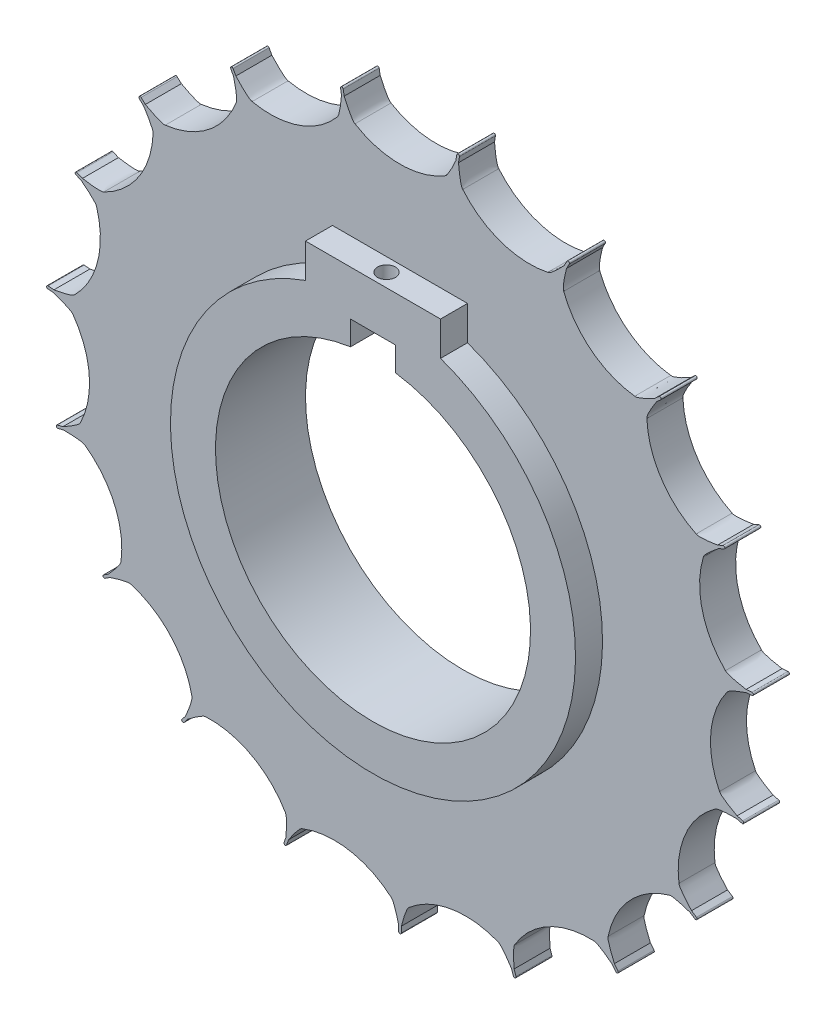
from build123d import *

# Parameters (mm, degrees)
BOSS_EXTRUDE1_DEPTH              = 2
BOSS_EXTRUDE1_DEPTH_BACK         = 2
SKETCH1_R                        = 36.375
BOSS_EXTRUDE2_DEPTH              = 9
SKETCH3_R                        = 39.875
BOSS_EXTRUDE3_DEPTH              = 4
CUT_EXTRUDE2_DEPTH               = 9
BOSS_EXTRUDE5_DEPTH              = 3
BOSS_EXTRUDE5_DEPTH_BACK         = 7
SKETCH7_R                        = 1
CUT_EXTRUDE3_DEPTH               = 10
CUT_EXTRUDE4_REACH               = 59.654
CIRPATTERN1_COUNT                = 19
BOSS_EXTRUDE6_DEPTH              = 4
FILLET1_RADIUS                   = 0.15
FILLET1_LENGTH                   = 4
CIRPATTERN2_COUNT                = 19
FILLET1_OF_CIRPATTERN2_2_RADIUS  = 0.15
FILLET1_OF_CIRPATTERN2_2_LENGTH  = 4
FILLET1_OF_CIRPATTERN2_3_RADIUS  = 0.15
FILLET1_OF_CIRPATTERN2_3_LENGTH  = 4
FILLET1_OF_CIRPATTERN2_4_RADIUS  = 0.15
FILLET1_OF_CIRPATTERN2_4_LENGTH  = 4
FILLET1_OF_CIRPATTERN2_5_RADIUS  = 0.15
FILLET1_OF_CIRPATTERN2_5_LENGTH  = 4
FILLET1_OF_CIRPATTERN2_6_RADIUS  = 0.15
FILLET1_OF_CIRPATTERN2_6_LENGTH  = 4
FILLET1_OF_CIRPATTERN2_7_RADIUS  = 0.15
FILLET1_OF_CIRPATTERN2_7_LENGTH  = 4
FILLET1_OF_CIRPATTERN2_8_RADIUS  = 0.15
FILLET1_OF_CIRPATTERN2_8_LENGTH  = 4
FILLET1_OF_CIRPATTERN2_9_RADIUS  = 0.15
FILLET1_OF_CIRPATTERN2_9_LENGTH  = 4
FILLET1_OF_CIRPATTERN2_10_RADIUS = 0.15
FILLET1_OF_CIRPATTERN2_10_LENGTH = 4
FILLET1_OF_CIRPATTERN2_11_RADIUS = 0.15
FILLET1_OF_CIRPATTERN2_11_LENGTH = 4
FILLET1_OF_CIRPATTERN2_12_RADIUS = 0.15
FILLET1_OF_CIRPATTERN2_12_LENGTH = 4
FILLET1_OF_CIRPATTERN2_13_RADIUS = 0.15
FILLET1_OF_CIRPATTERN2_13_LENGTH = 4
FILLET1_OF_CIRPATTERN2_14_RADIUS = 0.15
FILLET1_OF_CIRPATTERN2_14_LENGTH = 4
FILLET1_OF_CIRPATTERN2_15_RADIUS = 0.15
FILLET1_OF_CIRPATTERN2_15_LENGTH = 4
FILLET1_OF_CIRPATTERN2_16_RADIUS = 0.15
FILLET1_OF_CIRPATTERN2_16_LENGTH = 4
FILLET1_OF_CIRPATTERN2_17_RADIUS = 0.15
FILLET1_OF_CIRPATTERN2_17_LENGTH = 4
FILLET1_OF_CIRPATTERN2_18_RADIUS = 0.15
FILLET1_OF_CIRPATTERN2_18_LENGTH = 4
FILLET1_OF_CIRPATTERN2_19_RADIUS = 0.15
FILLET1_OF_CIRPATTERN2_19_LENGTH = 4


with BuildPart() as part:
    # Sketch1 → Boss-Extrude1 (new, two sides: drawn at the far end of the back side and taken through both)
    with BuildSketch(Plane.XY.offset(-BOSS_EXTRUDE1_DEPTH_BACK)):
        Circle(SKETCH1_R)
    extrude(amount=BOSS_EXTRUDE1_DEPTH + BOSS_EXTRUDE1_DEPTH_BACK)

    # Sketch2 → Boss-Extrude2 (add)
    with BuildSketch(Plane.XY.offset(2)):
        with BuildLine():
            add(Edge.make_bspline(
                [(-5, 36.029718636), (-5.16736878, 36.130582324), (-5.432588625, 36.539534021), (-5.85563855, 37.287033981), (-6.265720352, 38.310506492), (-6.754258246, 39.010871717), (-7.125429553, 39.23319868)],
                knots=[0, 0, 0, 0, 0.148725202, 0.36228267, 0.669737226, 1, 1, 1, 1], degree=3))
            ThreePointArc((-5, 36.029718636), (0, 36.375), (5, 36.029718636))
            add(Edge.make_bspline(
                [(5, 36.029718636), (5.16736878, 36.130582324), (5.432588625, 36.539534021), (5.85563855, 37.287033981), (6.265720352, 38.310506492), (6.754258246, 39.010871717), (7.125429553, 39.23319868)],
                knots=[0, 0, 0, 0, 0.148725202, 0.36228267, 0.669737226, 1, 1, 1, 1], degree=3))
            ThreePointArc((7.125429553, 39.23319868), (0, 39.875), (-7.125429553, 39.23319868))
        make_face()
        with BuildLine():
            ThreePointArc((5, 36.029718636), (0, 36.375), (-5, 36.029718636))
            ThreePointArc((-5, 36.029718636), (0, 34.639571543), (5, 36.029718636))
        make_face()
    extrude(amount=-BOSS_EXTRUDE2_DEPTH)

    # Sketch3 → Boss-Extrude3 (add)
    with BuildSketch(Plane.XY.offset(2)):
        Circle(SKETCH3_R)
    extrude(amount=-BOSS_EXTRUDE3_DEPTH)

    # Sketch5 → Cut-Extrude2 (cut)
    with BuildSketch(Plane.XY.offset(2)):
        with BuildLine():
            Line((-2.5, 20), (2.5, 20))
            Line((2.5, 20), (2.5, 17.320508076))
            ThreePointArc((2.5, 17.320508076), (0, -17.5), (-2.5, 17.320508076))
            Line((-2.5, 17.320508076), (-2.5, 20))
        make_face()
    extrude(amount=-CUT_EXTRUDE2_DEPTH, mode=Mode.SUBTRACT)

    # Sketch6 → Boss-Extrude5 (add, two sides: drawn at the far end of the back side and taken through both)
    with BuildSketch(Plane.XY.offset(2).offset(-BOSS_EXTRUDE5_DEPTH_BACK)):
        with BuildLine():
            Line((7.5, 21.213203436), (7.5, 25))
            Line((7.5, 25), (-7.5, 25))
            Line((-7.5, 25), (-7.5, 21.213203436))
            ThreePointArc((-7.5, 21.213203436), (0, -22.5), (7.5, 21.213203436))
        make_face()
        with BuildLine():
            Line((2.5, 17.320508076), (2.5, 20))
            Line((2.5, 20), (-2.5, 20))
            Line((-2.5, 20), (-2.5, 17.320508076))
            ThreePointArc((-2.5, 17.320508076), (0, -17.5), (2.5, 17.320508076))
        make_face(mode=Mode.SUBTRACT)
    extrude(amount=BOSS_EXTRUDE5_DEPTH + BOSS_EXTRUDE5_DEPTH_BACK)

    # Sketch7 → Cut-Extrude3 (cut)
    with BuildSketch(Plane(origin=(0, 25, 0), x_dir=(1, 0, 0), z_dir=(0, 1, 0))):
        with Locations(Location((0, -3.5, 0), (0, 0, 270))):
            Circle(SKETCH7_R)
    extrude(amount=-CUT_EXTRUDE3_DEPTH, mode=Mode.SUBTRACT)

    # Sketch11 → Cut-Extrude4 (cut, up to next)
    with BuildSketch(Plane(origin=(0, 0, -7), x_dir=(-1, 0, 0), z_dir=(0, 0, -1)), mode=Mode.PRIVATE) as cut_extrude4_sk1:
        with BuildLine():
            ThreePointArc((7.125429553, 39.23319868), (0, 39.875), (-7.125429553, 39.23319868))
            add(Edge.make_bspline(
                [(-7.125429553, 39.23319868), (-6.754258246, 39.010871717), (-6.265720352, 38.310506492), (-5.85563855, 37.287033981), (-5.432588625, 36.539534021), (-5.16736878, 36.130582324), (-5, 36.029718636)],
                knots=[0, 0, 0, 0, 0.330262774, 0.63771733, 0.851274798, 1, 1, 1, 1], degree=3))
            ThreePointArc((-5, 36.029718636), (0, 34.639571543), (5, 36.029718636))
            add(Edge.make_bspline(
                [(5, 36.029718636), (5.16736878, 36.130582324), (5.432588625, 36.539534021), (5.85563855, 37.287033981), (6.265720352, 38.310506492), (6.754258246, 39.010871717), (7.125429553, 39.23319868)],
                knots=[0, 0, 0, 0, 0.148725202, 0.36228267, 0.669737226, 1, 1, 1, 1], degree=3))
        make_face()
    cut_extrude4_tool1 = extrude(cut_extrude4_sk1.sketch, amount=-CUT_EXTRUDE4_REACH, mode=Mode.PRIVATE) & part.part
    cut_extrude4 = cut_extrude4_tool1.solids().sort_by_distance((0, 37.521831, -7))[0]
    add(cut_extrude4, mode=Mode.SUBTRACT)

    # CirPattern1: Cut-Extrude4 ×19 about axis
    cirpattern1_axis = Axis((0, 0, 0), (0, 0, -1))
    for i in range(1, CIRPATTERN1_COUNT):
        add(cut_extrude4.rotate(cirpattern1_axis, i * 360 / CIRPATTERN1_COUNT), mode=Mode.SUBTRACT)

    # Sketch12 → Boss-Extrude6 (add)
    with BuildSketch(Plane.XY.offset(2)):
        Polygon((-6.4993162, 38.036936687), (-6.203407797, 38.086314991), (-6.335083273, 38.875404067), (-6.630991676, 38.826025763), align=None)
    boss_extrude6 = extrude(amount=-BOSS_EXTRUDE6_DEPTH)

    # Fillet1: full round fillet: the end face becomes a half cylinder, R = half its width
    fillet1_face = Plane((-6.483037475, 38.850714915, 0), x_dir=(0, 0, 1), z_dir=(-0.164594345497, 0.98636134425, 0))  # on the end face: x along it, z out of the body
    fillet1_slab = fillet1_face.offset(-FILLET1_RADIUS / 2) * Box(FILLET1_LENGTH, 2 * FILLET1_RADIUS, FILLET1_RADIUS, mode=Mode.PRIVATE)  # the body's end, R deep
    fillet1_round = Plane((-6.458348323, 38.702760713, 0), x_dir=(-0.164594345497, 0.98636134425, 0), z_dir=(0, 0, 1)) * Cylinder(FILLET1_RADIUS, FILLET1_LENGTH, mode=Mode.PRIVATE)  # its axis R under the face
    add(fillet1_slab - fillet1_round, mode=Mode.SUBTRACT)

    # CirPattern2: Boss-Extrude6 ×19 about axis
    cirpattern2_axis = Axis((0, 0, 0), (0, 0, 1))
    for i in range(1, CIRPATTERN2_COUNT):
        add(boss_extrude6.rotate(cirpattern2_axis, i * 360 / CIRPATTERN2_COUNT))

    # Fillet1 of CirPattern2 2: full round fillet: the end face becomes a half cylinder, R = half its width
    fillet1_of_cirpattern2_2_face = Plane((-18.746575134, 34.640637192, 0), x_dir=(0, 0, 1), z_dir=(-0.475947174779, 0.879473869322, 0))  # on the end face: x along it, z out of the body
    fillet1_of_cirpattern2_2_slab = fillet1_of_cirpattern2_2_face.offset(-FILLET1_OF_CIRPATTERN2_2_RADIUS / 2) * Box(FILLET1_OF_CIRPATTERN2_2_LENGTH, 2 * FILLET1_OF_CIRPATTERN2_2_RADIUS, FILLET1_OF_CIRPATTERN2_2_RADIUS, mode=Mode.PRIVATE)  # the body's end, R deep
    fillet1_of_cirpattern2_2_round = Plane((-18.675183058, 34.508716112, 0), x_dir=(-0.475947174779, 0.879473869322, 0), z_dir=(0, 0, 1)) * Cylinder(FILLET1_OF_CIRPATTERN2_2_RADIUS, FILLET1_OF_CIRPATTERN2_2_LENGTH, mode=Mode.PRIVATE)  # its axis R under the face
    add(fillet1_of_cirpattern2_2_slab - fillet1_of_cirpattern2_2_round, mode=Mode.SUBTRACT)

    # Fillet1 of CirPattern2 3: full round fillet: the end face becomes a half cylinder, R = half its width
    fillet1_of_cirpattern2_3_face = Plane((-28.978630493, 26.676708924, 0), x_dir=(0, 0, 1), z_dir=(-0.735723742593, 0.677281754209, 0))  # on the end face: x along it, z out of the body
    fillet1_of_cirpattern2_3_slab = fillet1_of_cirpattern2_3_face.offset(-FILLET1_OF_CIRPATTERN2_3_RADIUS / 2) * Box(FILLET1_OF_CIRPATTERN2_3_LENGTH, 2 * FILLET1_OF_CIRPATTERN2_3_RADIUS, FILLET1_OF_CIRPATTERN2_3_RADIUS, mode=Mode.PRIVATE)  # the body's end, R deep
    fillet1_of_cirpattern2_3_round = Plane((-28.868271932, 26.575116661, 0), x_dir=(-0.735723742593, 0.677281754209, 0), z_dir=(0, 0, 1)) * Cylinder(FILLET1_OF_CIRPATTERN2_3_RADIUS, FILLET1_OF_CIRPATTERN2_3_LENGTH, mode=Mode.PRIVATE)  # its axis R under the face
    add(fillet1_of_cirpattern2_3_slab - fillet1_of_cirpattern2_3_round, mode=Mode.SUBTRACT)

    # Fillet1 of CirPattern2 4: full round fillet: the end face becomes a half cylinder, R = half its width
    fillet1_of_cirpattern2_4_face = Plane((-36.070401589, 15.821945313, 0), x_dir=(0, 0, 1), z_dir=(-0.915773226967, 0.401695651919, 0))  # on the end face: x along it, z out of the body
    fillet1_of_cirpattern2_4_slab = fillet1_of_cirpattern2_4_face.offset(-FILLET1_OF_CIRPATTERN2_4_RADIUS / 2) * Box(FILLET1_OF_CIRPATTERN2_4_LENGTH, 2 * FILLET1_OF_CIRPATTERN2_4_RADIUS, FILLET1_OF_CIRPATTERN2_4_RADIUS, mode=Mode.PRIVATE)  # the body's end, R deep
    fillet1_of_cirpattern2_4_round = Plane((-35.933035605, 15.761690965, 0), x_dir=(-0.915773226967, 0.401695651919, 0), z_dir=(0, 0, 1)) * Cylinder(FILLET1_OF_CIRPATTERN2_4_RADIUS, FILLET1_OF_CIRPATTERN2_4_LENGTH, mode=Mode.PRIVATE)  # its axis R under the face
    add(fillet1_of_cirpattern2_4_slab - fillet1_of_cirpattern2_4_round, mode=Mode.SUBTRACT)

    # Fillet1 of CirPattern2 5: full round fillet: the end face becomes a half cylinder, R = half its width
    fillet1_of_cirpattern2_5_face = Plane((-39.253384983, 3.252628424, 0), x_dir=(0, 0, 1), z_dir=(-0.996584472513, 0.082579592793, 0))  # on the end face: x along it, z out of the body
    fillet1_of_cirpattern2_5_slab = fillet1_of_cirpattern2_5_face.offset(-FILLET1_OF_CIRPATTERN2_5_RADIUS / 2) * Box(FILLET1_OF_CIRPATTERN2_5_LENGTH, 2 * FILLET1_OF_CIRPATTERN2_5_RADIUS, FILLET1_OF_CIRPATTERN2_5_RADIUS, mode=Mode.PRIVATE)  # the body's end, R deep
    fillet1_of_cirpattern2_5_round = Plane((-39.103897312, 3.240241485, 0), x_dir=(-0.996584472513, 0.082579592793, 0), z_dir=(0, 0, 1)) * Cylinder(FILLET1_OF_CIRPATTERN2_5_RADIUS, FILLET1_OF_CIRPATTERN2_5_LENGTH, mode=Mode.PRIVATE)  # its axis R under the face
    add(fillet1_of_cirpattern2_5_slab - fillet1_of_cirpattern2_5_round, mode=Mode.SUBTRACT)

    # Fillet1 of CirPattern2 6: full round fillet: the end face becomes a half cylinder, R = half its width
    fillet1_of_cirpattern2_6_face = Plane((-38.182655035, -9.669161224, 0), x_dir=(0, 0, 1), z_dir=(-0.969400326861, -0.245485246566, 0))  # on the end face: x along it, z out of the body
    fillet1_of_cirpattern2_6_slab = fillet1_of_cirpattern2_6_face.offset(-FILLET1_OF_CIRPATTERN2_6_RADIUS / 2) * Box(FILLET1_OF_CIRPATTERN2_6_LENGTH, 2 * FILLET1_OF_CIRPATTERN2_6_RADIUS, FILLET1_OF_CIRPATTERN2_6_RADIUS, mode=Mode.PRIVATE)  # the body's end, R deep
    fillet1_of_cirpattern2_6_round = Plane((-38.037244986, -9.632338437, 0), x_dir=(-0.969400326861, -0.245485246566, 0), z_dir=(0, 0, 1)) * Cylinder(FILLET1_OF_CIRPATTERN2_6_RADIUS, FILLET1_OF_CIRPATTERN2_6_LENGTH, mode=Mode.PRIVATE)  # its axis R under the face
    add(fillet1_of_cirpattern2_6_slab - fillet1_of_cirpattern2_6_round, mode=Mode.SUBTRACT)

    # Fillet1 of CirPattern2 7: full round fillet: the end face becomes a half cylinder, R = half its width
    fillet1_of_cirpattern2_7_face = Plane((-32.974241949, -21.543147221, 0), x_dir=(0, 0, 1), z_dir=(-0.837166613998, -0.546947950364, 0))  # on the end face: x along it, z out of the body
    fillet1_of_cirpattern2_7_slab = fillet1_of_cirpattern2_7_face.offset(-FILLET1_OF_CIRPATTERN2_7_RADIUS / 2) * Box(FILLET1_OF_CIRPATTERN2_7_LENGTH, 2 * FILLET1_OF_CIRPATTERN2_7_RADIUS, FILLET1_OF_CIRPATTERN2_7_RADIUS, mode=Mode.PRIVATE)  # the body's end, R deep
    fillet1_of_cirpattern2_7_round = Plane((-32.848666957, -21.461105028, 0), x_dir=(-0.837166613998, -0.546947950364, 0), z_dir=(0, 0, 1)) * Cylinder(FILLET1_OF_CIRPATTERN2_7_RADIUS, FILLET1_OF_CIRPATTERN2_7_LENGTH, mode=Mode.PRIVATE)  # its axis R under the face
    add(fillet1_of_cirpattern2_7_slab - fillet1_of_cirpattern2_7_round, mode=Mode.SUBTRACT)

    # Fillet1 of CirPattern2 8: full round fillet: the end face becomes a half cylinder, R = half its width
    fillet1_of_cirpattern2_8_face = Plane((-24.1925581, -31.082598941, 0), x_dir=(0, 0, 1), z_dir=(-0.614212908529, -0.789140356968, 0))  # on the end face: x along it, z out of the body
    fillet1_of_cirpattern2_8_slab = fillet1_of_cirpattern2_8_face.offset(-FILLET1_OF_CIRPATTERN2_8_RADIUS / 2) * Box(FILLET1_OF_CIRPATTERN2_8_LENGTH, 2 * FILLET1_OF_CIRPATTERN2_8_RADIUS, FILLET1_OF_CIRPATTERN2_8_RADIUS, mode=Mode.PRIVATE)  # the body's end, R deep
    fillet1_of_cirpattern2_8_round = Plane((-24.100426164, -30.964227887, 0), x_dir=(-0.614212908529, -0.789140356968, 0), z_dir=(0, 0, 1)) * Cylinder(FILLET1_OF_CIRPATTERN2_8_RADIUS, FILLET1_OF_CIRPATTERN2_8_LENGTH, mode=Mode.PRIVATE)  # its axis R under the face
    add(fillet1_of_cirpattern2_8_slab - fillet1_of_cirpattern2_8_round, mode=Mode.SUBTRACT)

    # Fillet1 of CirPattern2 9: full round fillet: the end face becomes a half cylinder, R = half its width
    fillet1_of_cirpattern2_9_face = Plane((-12.789235194, -37.253768769, 0), x_dir=(0, 0, 1), z_dir=(-0.324699703927, -0.945817161121, 0))  # on the end face: x along it, z out of the body
    fillet1_of_cirpattern2_9_slab = fillet1_of_cirpattern2_9_face.offset(-FILLET1_OF_CIRPATTERN2_9_RADIUS / 2) * Box(FILLET1_OF_CIRPATTERN2_9_LENGTH, 2 * FILLET1_OF_CIRPATTERN2_9_RADIUS, FILLET1_OF_CIRPATTERN2_9_RADIUS, mode=Mode.PRIVATE)  # the body's end, R deep
    fillet1_of_cirpattern2_9_round = Plane((-12.740530238, -37.111896195, 0), x_dir=(-0.324699703927, -0.945817161121, 0), z_dir=(0, 0, 1)) * Cylinder(FILLET1_OF_CIRPATTERN2_9_RADIUS, FILLET1_OF_CIRPATTERN2_9_LENGTH, mode=Mode.PRIVATE)  # its axis R under the face
    add(fillet1_of_cirpattern2_9_slab - fillet1_of_cirpattern2_9_round, mode=Mode.SUBTRACT)

    # Fillet1 of CirPattern2 10: full round fillet: the end face becomes a half cylinder, R = half its width
    fillet1_of_cirpattern2_10_face = Plane((-2.1e-07, -39.387914699, 0), x_dir=(0, 0, 1), z_dir=(-2.48168e-07, -1.0, 0))  # on the end face: x along it, z out of the body
    fillet1_of_cirpattern2_10_slab = fillet1_of_cirpattern2_10_face.offset(-FILLET1_OF_CIRPATTERN2_10_RADIUS / 2) * Box(FILLET1_OF_CIRPATTERN2_10_LENGTH, 2 * FILLET1_OF_CIRPATTERN2_10_RADIUS, FILLET1_OF_CIRPATTERN2_10_RADIUS, mode=Mode.PRIVATE)  # the body's end, R deep
    fillet1_of_cirpattern2_10_round = Plane((-1.73e-07, -39.237914699, 0), x_dir=(-2.48168e-07, -1.0, 0), z_dir=(0, 0, 1)) * Cylinder(FILLET1_OF_CIRPATTERN2_10_RADIUS, FILLET1_OF_CIRPATTERN2_10_LENGTH, mode=Mode.PRIVATE)  # its axis R under the face
    add(fillet1_of_cirpattern2_10_slab - fillet1_of_cirpattern2_10_round, mode=Mode.SUBTRACT)

    # Fillet1 of CirPattern2 11: full round fillet: the end face becomes a half cylinder, R = half its width
    fillet1_of_cirpattern2_11_face = Plane((12.789234797, -37.253768905, 0), x_dir=(0, 0, 1), z_dir=(0.324699234483, -0.945817322281, 0))  # on the end face: x along it, z out of the body
    fillet1_of_cirpattern2_11_slab = fillet1_of_cirpattern2_11_face.offset(-FILLET1_OF_CIRPATTERN2_11_RADIUS / 2) * Box(FILLET1_OF_CIRPATTERN2_11_LENGTH, 2 * FILLET1_OF_CIRPATTERN2_11_RADIUS, FILLET1_OF_CIRPATTERN2_11_RADIUS, mode=Mode.PRIVATE)  # the body's end, R deep
    fillet1_of_cirpattern2_11_round = Plane((12.740529912, -37.111896307, 0), x_dir=(0.324699234483, -0.945817322281, 0), z_dir=(0, 0, 1)) * Cylinder(FILLET1_OF_CIRPATTERN2_11_RADIUS, FILLET1_OF_CIRPATTERN2_11_LENGTH, mode=Mode.PRIVATE)  # its axis R under the face
    add(fillet1_of_cirpattern2_11_slab - fillet1_of_cirpattern2_11_round, mode=Mode.SUBTRACT)

    # Fillet1 of CirPattern2 12: full round fillet: the end face becomes a half cylinder, R = half its width
    fillet1_of_cirpattern2_12_face = Plane((24.192557769, -31.082599198, 0), x_dir=(0, 0, 1), z_dir=(0.61421251685, -0.789140661825, 0))  # on the end face: x along it, z out of the body
    fillet1_of_cirpattern2_12_slab = fillet1_of_cirpattern2_12_face.offset(-FILLET1_OF_CIRPATTERN2_12_RADIUS / 2) * Box(FILLET1_OF_CIRPATTERN2_12_LENGTH, 2 * FILLET1_OF_CIRPATTERN2_12_RADIUS, FILLET1_OF_CIRPATTERN2_12_RADIUS, mode=Mode.PRIVATE)  # the body's end, R deep
    fillet1_of_cirpattern2_12_round = Plane((24.100425891, -30.964228099, 0), x_dir=(0.61421251685, -0.789140661825, 0), z_dir=(0, 0, 1)) * Cylinder(FILLET1_OF_CIRPATTERN2_12_RADIUS, FILLET1_OF_CIRPATTERN2_12_LENGTH, mode=Mode.PRIVATE)  # its axis R under the face
    add(fillet1_of_cirpattern2_12_slab - fillet1_of_cirpattern2_12_round, mode=Mode.SUBTRACT)

    # Fillet1 of CirPattern2 13: full round fillet: the end face becomes a half cylinder, R = half its width
    fillet1_of_cirpattern2_13_face = Plane((32.97424172, -21.543147572, 0), x_dir=(0, 0, 1), z_dir=(0.837166342527, -0.546948365881, 0))  # on the end face: x along it, z out of the body
    fillet1_of_cirpattern2_13_slab = fillet1_of_cirpattern2_13_face.offset(-FILLET1_OF_CIRPATTERN2_13_RADIUS / 2) * Box(FILLET1_OF_CIRPATTERN2_13_LENGTH, 2 * FILLET1_OF_CIRPATTERN2_13_RADIUS, FILLET1_OF_CIRPATTERN2_13_RADIUS, mode=Mode.PRIVATE)  # the body's end, R deep
    fillet1_of_cirpattern2_13_round = Plane((32.848666769, -21.461105317, 0), x_dir=(0.837166342527, -0.546948365881, 0), z_dir=(0, 0, 1)) * Cylinder(FILLET1_OF_CIRPATTERN2_13_RADIUS, FILLET1_OF_CIRPATTERN2_13_LENGTH, mode=Mode.PRIVATE)  # its axis R under the face
    add(fillet1_of_cirpattern2_13_slab - fillet1_of_cirpattern2_13_round, mode=Mode.SUBTRACT)

    # Fillet1 of CirPattern2 14: full round fillet: the end face becomes a half cylinder, R = half its width
    fillet1_of_cirpattern2_14_face = Plane((38.182654932, -9.669161631, 0), x_dir=(0, 0, 1), z_dir=(0.969400205018, -0.245485727715, 0))  # on the end face: x along it, z out of the body
    fillet1_of_cirpattern2_14_slab = fillet1_of_cirpattern2_14_face.offset(-FILLET1_OF_CIRPATTERN2_14_RADIUS / 2) * Box(FILLET1_OF_CIRPATTERN2_14_LENGTH, 2 * FILLET1_OF_CIRPATTERN2_14_RADIUS, FILLET1_OF_CIRPATTERN2_14_RADIUS, mode=Mode.PRIVATE)  # the body's end, R deep
    fillet1_of_cirpattern2_14_round = Plane((38.037244901, -9.632338772, 0), x_dir=(0.969400205018, -0.245485727715, 0), z_dir=(0, 0, 1)) * Cylinder(FILLET1_OF_CIRPATTERN2_14_RADIUS, FILLET1_OF_CIRPATTERN2_14_LENGTH, mode=Mode.PRIVATE)  # its axis R under the face
    add(fillet1_of_cirpattern2_14_slab - fillet1_of_cirpattern2_14_round, mode=Mode.SUBTRACT)

    # Fillet1 of CirPattern2 15: full round fillet: the end face becomes a half cylinder, R = half its width
    fillet1_of_cirpattern2_15_face = Plane((39.253385018, 3.252628006, 0), x_dir=(0, 0, 1), z_dir=(0.9965845135, 0.082579098152, 0))  # on the end face: x along it, z out of the body
    fillet1_of_cirpattern2_15_slab = fillet1_of_cirpattern2_15_face.offset(-FILLET1_OF_CIRPATTERN2_15_RADIUS / 2) * Box(FILLET1_OF_CIRPATTERN2_15_LENGTH, 2 * FILLET1_OF_CIRPATTERN2_15_RADIUS, FILLET1_OF_CIRPATTERN2_15_RADIUS, mode=Mode.PRIVATE)  # the body's end, R deep
    fillet1_of_cirpattern2_15_round = Plane((39.103897341, 3.240241141, 0), x_dir=(0.9965845135, 0.082579098152, 0), z_dir=(0, 0, 1)) * Cylinder(FILLET1_OF_CIRPATTERN2_15_RADIUS, FILLET1_OF_CIRPATTERN2_15_LENGTH, mode=Mode.PRIVATE)  # its axis R under the face
    add(fillet1_of_cirpattern2_15_slab - fillet1_of_cirpattern2_15_round, mode=Mode.SUBTRACT)

    # Fillet1 of CirPattern2 16: full round fillet: the end face becomes a half cylinder, R = half its width
    fillet1_of_cirpattern2_16_face = Plane((36.070401758, 15.821944929, 0), x_dir=(0, 0, 1), z_dir=(0.915773426343, 0.401695197387, 0))  # on the end face: x along it, z out of the body
    fillet1_of_cirpattern2_16_slab = fillet1_of_cirpattern2_16_face.offset(-FILLET1_OF_CIRPATTERN2_16_RADIUS / 2) * Box(FILLET1_OF_CIRPATTERN2_16_LENGTH, 2 * FILLET1_OF_CIRPATTERN2_16_RADIUS, FILLET1_OF_CIRPATTERN2_16_RADIUS, mode=Mode.PRIVATE)  # the body's end, R deep
    fillet1_of_cirpattern2_16_round = Plane((35.933035744, 15.761690649, 0), x_dir=(0.915773426343, 0.401695197387, 0), z_dir=(0, 0, 1)) * Cylinder(FILLET1_OF_CIRPATTERN2_16_RADIUS, FILLET1_OF_CIRPATTERN2_16_LENGTH, mode=Mode.PRIVATE)  # its axis R under the face
    add(fillet1_of_cirpattern2_16_slab - fillet1_of_cirpattern2_16_round, mode=Mode.SUBTRACT)

    # Fillet1 of CirPattern2 17: full round fillet: the end face becomes a half cylinder, R = half its width
    fillet1_of_cirpattern2_17_face = Plane((28.978630777, 26.676708616, 0), x_dir=(0, 0, 1), z_dir=(0.735724078753, 0.677281389042, 0))  # on the end face: x along it, z out of the body
    fillet1_of_cirpattern2_17_slab = fillet1_of_cirpattern2_17_face.offset(-FILLET1_OF_CIRPATTERN2_17_RADIUS / 2) * Box(FILLET1_OF_CIRPATTERN2_17_LENGTH, 2 * FILLET1_OF_CIRPATTERN2_17_RADIUS, FILLET1_OF_CIRPATTERN2_17_RADIUS, mode=Mode.PRIVATE)  # the body's end, R deep
    fillet1_of_cirpattern2_17_round = Plane((28.868272165, 26.575116408, 0), x_dir=(0.735724078753, 0.677281389042, 0), z_dir=(0, 0, 1)) * Cylinder(FILLET1_OF_CIRPATTERN2_17_RADIUS, FILLET1_OF_CIRPATTERN2_17_LENGTH, mode=Mode.PRIVATE)  # its axis R under the face
    add(fillet1_of_cirpattern2_17_slab - fillet1_of_cirpattern2_17_round, mode=Mode.SUBTRACT)

    # Fillet1 of CirPattern2 18: full round fillet: the end face becomes a half cylinder, R = half its width
    fillet1_of_cirpattern2_18_face = Plane((18.746575502, 34.640636992, 0), x_dir=(0, 0, 1), z_dir=(0.475947611295, 0.879473633091, 0))  # on the end face: x along it, z out of the body
    fillet1_of_cirpattern2_18_slab = fillet1_of_cirpattern2_18_face.offset(-FILLET1_OF_CIRPATTERN2_18_RADIUS / 2) * Box(FILLET1_OF_CIRPATTERN2_18_LENGTH, 2 * FILLET1_OF_CIRPATTERN2_18_RADIUS, FILLET1_OF_CIRPATTERN2_18_RADIUS, mode=Mode.PRIVATE)  # the body's end, R deep
    fillet1_of_cirpattern2_18_round = Plane((18.67518336, 34.508715947, 0), x_dir=(0.475947611295, 0.879473633091, 0), z_dir=(0, 0, 1)) * Cylinder(FILLET1_OF_CIRPATTERN2_18_RADIUS, FILLET1_OF_CIRPATTERN2_18_LENGTH, mode=Mode.PRIVATE)  # its axis R under the face
    add(fillet1_of_cirpattern2_18_slab - fillet1_of_cirpattern2_18_round, mode=Mode.SUBTRACT)

    # Fillet1 of CirPattern2 19: full round fillet: the end face becomes a half cylinder, R = half its width
    fillet1_of_cirpattern2_19_face = Plane((6.483037889, 38.850714846, 0), x_dir=(0, 0, 1), z_dir=(0.164594835064, 0.986361262556, 0))  # on the end face: x along it, z out of the body
    fillet1_of_cirpattern2_19_slab = fillet1_of_cirpattern2_19_face.offset(-FILLET1_OF_CIRPATTERN2_19_RADIUS / 2) * Box(FILLET1_OF_CIRPATTERN2_19_LENGTH, 2 * FILLET1_OF_CIRPATTERN2_19_RADIUS, FILLET1_OF_CIRPATTERN2_19_RADIUS, mode=Mode.PRIVATE)  # the body's end, R deep
    fillet1_of_cirpattern2_19_round = Plane((6.458348664, 38.702760657, 0), x_dir=(0.164594835064, 0.986361262556, 0), z_dir=(0, 0, 1)) * Cylinder(FILLET1_OF_CIRPATTERN2_19_RADIUS, FILLET1_OF_CIRPATTERN2_19_LENGTH, mode=Mode.PRIVATE)  # its axis R under the face
    add(fillet1_of_cirpattern2_19_slab - fillet1_of_cirpattern2_19_round, mode=Mode.SUBTRACT)


solid = part.part
